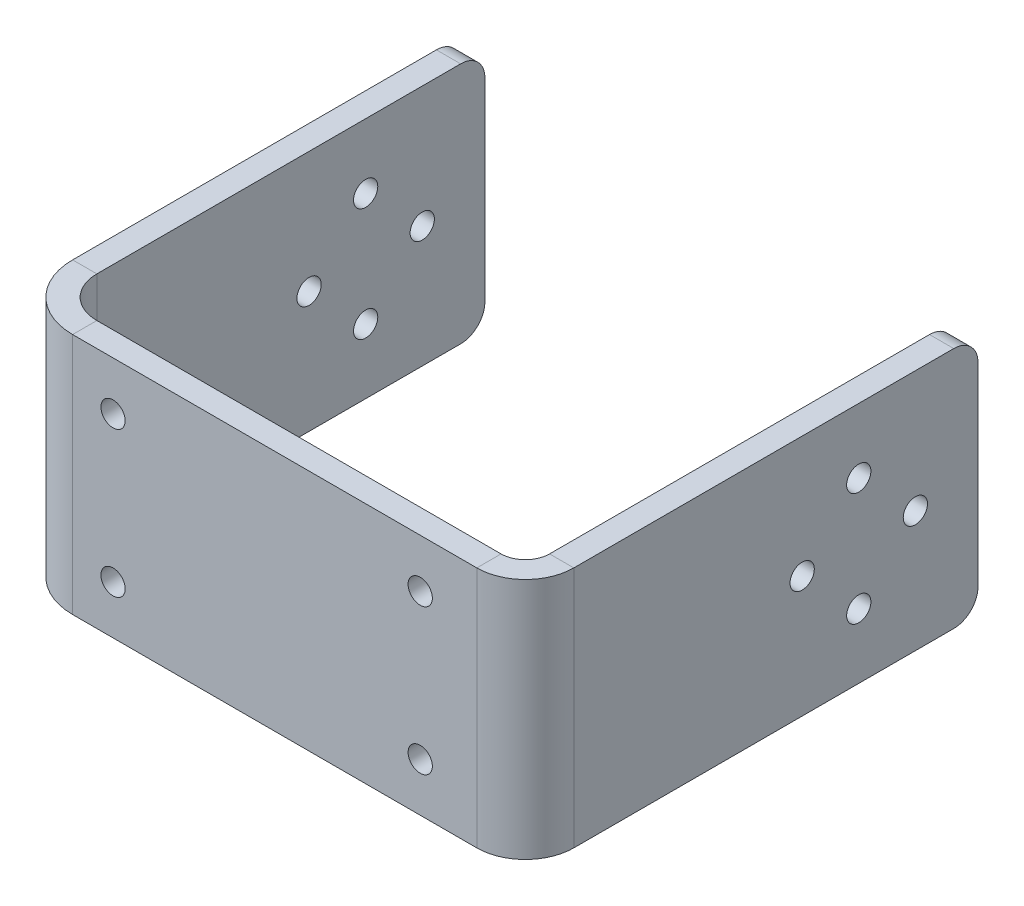
from build123d import *

# Parameters (mm, degrees)
SKETCH_1_W                       = 58
SKETCH_1_H                       = 30
SM_BASE_FLANGE_2_DEPTH           = 3
SM_EDGE_FLANGE_1_STRIP_W         = 22
SM_EDGE_FLANGE_1_STRIP_H         = 3
SM_EDGE_FLANGE_1_STRIP_CUT_DEPTH = 30
SM_EDGE_FLANGE_1_DEPTH           = 30
SM_EDGE_FLANGE_2_STRIP_W         = 18
SM_EDGE_FLANGE_2_STRIP_H         = 3
SM_EDGE_FLANGE_2_STRIP_CUT_DEPTH = 30
SM_EDGE_FLANGE_2_DEPTH           = 30
FILLET_1_R                       = 3
SKETCH_14_R                      = 1.5
CUT_EXTRUDE_1_DEPTH              = 87.353922899
SKETCH_15_R                      = 1.5
CUT_EXTRUDE_2_DEPTH              = 67.219332525


# Sheet-metal steps are written as plain solids
with BuildPart() as part:
    # Sketch 1 → 基体-法兰2 (new body)
    with BuildSketch(Plane.XY):
        Rectangle(SKETCH_1_W, SKETCH_1_H)
    extrude(amount=-SM_BASE_FLANGE_2_DEPTH)

    # 边线-法兰1 strip (across the edge) → 边线-法兰1 strip cut (cut)
    with BuildSketch(Plane(origin=(-29, -15, -3), x_dir=(1, 0, 0), z_dir=(0, 1, 0))):
        with Locations((-6, -1.5)):
            Rectangle(SM_EDGE_FLANGE_1_STRIP_W, SM_EDGE_FLANGE_1_STRIP_H)
    extrude(amount=SM_EDGE_FLANGE_1_STRIP_CUT_DEPTH, mode=Mode.SUBTRACT)

    # 边线-法兰1 section (across the edge) → 边线-法兰1 (add)
    with BuildSketch(Plane(origin=(-29, -15, -3), x_dir=(1, 0, 0), z_dir=(0, 1, 0))):
        with BuildLine():
            Line((-3, 5), (-3, 53))
            Line((-3, 53), (0, 53))
            Line((0, 53), (0, 5))
            ThreePointArc((0, 5), (1.464466094, 1.464466094), (5, 0))
            Line((5, 0), (5, -3))
            ThreePointArc((5, -3), (-0.656854249, -0.656854249), (-3, 5))
        make_face()
    extrude(amount=SM_EDGE_FLANGE_1_DEPTH)

    # 边线-法兰2 strip (across the edge) → 边线-法兰2 strip cut (cut)
    with BuildSketch(Plane(origin=(29, 15, -3), x_dir=(-1, 0, 0), z_dir=(0, -1, 0))):
        with Locations((-6, -1.5)):
            Rectangle(SM_EDGE_FLANGE_2_STRIP_W, SM_EDGE_FLANGE_2_STRIP_H)
    extrude(amount=SM_EDGE_FLANGE_2_STRIP_CUT_DEPTH, mode=Mode.SUBTRACT)

    # 边线-法兰2 section (across the edge) → 边线-法兰2 (add)
    with BuildSketch(Plane(origin=(29, 15, -3), x_dir=(-1, 0, 0), z_dir=(0, -1, 0))):
        with BuildLine():
            Line((-3, 3), (-3, 53))
            Line((-3, 53), (0, 53))
            Line((0, 53), (0, 3))
            ThreePointArc((0, 3), (0.878679656, 0.878679656), (3, 0))
            Line((3, 0), (3, -3))
            ThreePointArc((3, -3), (-1.242640687, -1.242640687), (-3, 3))
        make_face()
    extrude(amount=SM_EDGE_FLANGE_2_DEPTH)

    # 圆角1
    fillet_1_edges = [part.edges().sort_by_distance(p)[0] for p in [
        (-30.5, -15, -56),
        (-30.5, 15, -56),
        (30.5, 15, -56),
        (30.5, -15, -56),
    ]]
    fillet(fillet_1_edges, radius=FILLET_1_R)

    # 草图14 → 切除-拉伸1 (cut, through all)
    with BuildSketch(Plane.ZY.offset(32)):
        with Locations((-34.25, 0)):
            Circle(SKETCH_14_R)
        with Locations((-41.25, 7)):
            Circle(SKETCH_14_R)
        with Locations((-48.25, 0)):
            Circle(SKETCH_14_R)
        with Locations((-41.25, -7)):
            Circle(SKETCH_14_R)
    extrude(amount=-CUT_EXTRUDE_1_DEPTH, mode=Mode.SUBTRACT)

    # 草图15 → 切除-拉伸2 (cut, through all)
    with BuildSketch(Plane.XY):
        with Locations((19, 9)):
            Circle(SKETCH_15_R)
        with Locations((19, -9)):
            Circle(SKETCH_15_R)
        with Locations((-19, -9)):
            Circle(SKETCH_15_R)
        with Locations((-19, 9)):
            Circle(SKETCH_15_R)
    extrude(amount=-CUT_EXTRUDE_2_DEPTH, mode=Mode.SUBTRACT)


solid = part.part
